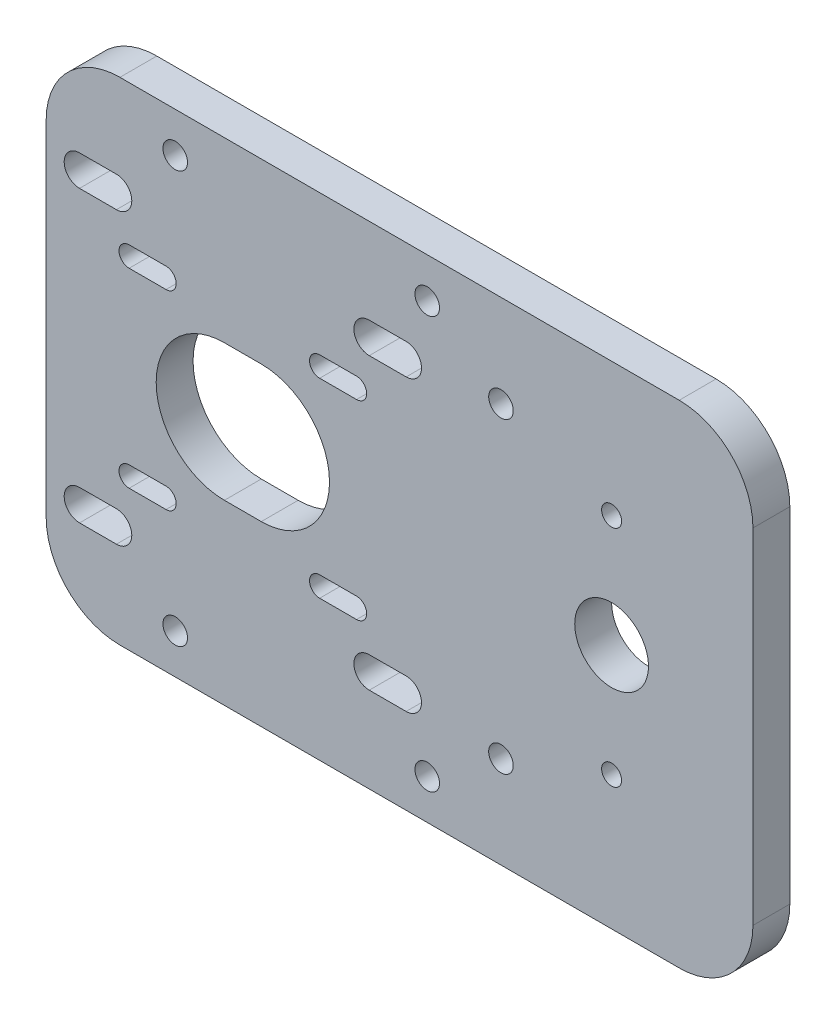
from build123d import *

# Parameters (mm, degrees)
CROQUIS1_W              = 115
CROQUIS1_H              = 80
SALIENTE_EXTRUIR1_DEPTH = 6
CROQUIS2_R              = 6
CROQUIS2_R_2            = 1.625
CROQUIS2_R_3            = 2
CORTAR_EXTRUIR1_DEPTH   = 141.2176879
REDONDEO1_R             = 12
CROQUIS3_R              = 2
CORTAR_EXTRUIR2_DEPTH   = 141.2176879


with BuildPart() as part:
    # Croquis1 → Saliente-Extruir1 (new body)
    with BuildSketch(Plane.XY):
        with Locations((57.5, 40)):
            Rectangle(CROQUIS1_W, CROQUIS1_H)
    extrude(amount=SALIENTE_EXTRUIR1_DEPTH)

    # Croquis2 → Cortar-Extruir1 (cut, through all)
    with BuildSketch(Plane(origin=(0, 0, 0), x_dir=(-1, 0, 0), z_dir=(0, 0, -1))):
        with Locations((-92, 40)):
            Circle(CROQUIS2_R)
        with Locations((-92, 21.75)):
            Circle(CROQUIS2_R_2)
        with Locations((-92, 58.25)):
            Circle(CROQUIS2_R_2)
        with Locations((-74, 15)):
            Circle(CROQUIS2_R_3)
        with Locations((-74, 65)):
            Circle(CROQUIS2_R_3)
        with BuildLine():
            Line((-29, 28.9), (-35, 28.9))
            ThreePointArc((-35, 28.9), (-46.1, 40), (-35, 51.1))
            Line((-35, 51.1), (-29, 51.1))
            ThreePointArc((-29, 51.1), (-17.9, 40), (-29, 28.9))
        make_face()
        with BuildLine():
            Line((-13.5, 22.85), (-19.5, 22.85))
            ThreePointArc((-19.5, 22.85), (-21.15, 24.5), (-19.5, 26.15))
            Line((-19.5, 26.15), (-13.5, 26.15))
            ThreePointArc((-13.5, 26.15), (-11.85, 24.5), (-13.5, 22.85))
        make_face()
        with BuildLine():
            Line((-44.5, 53.85), (-50.5, 53.85))
            ThreePointArc((-50.5, 53.85), (-52.15, 55.5), (-50.5, 57.15))
            Line((-50.5, 57.15), (-44.5, 57.15))
            ThreePointArc((-44.5, 57.15), (-42.85, 55.5), (-44.5, 53.85))
        make_face()
        with BuildLine():
            Line((-44.5, 22.85), (-50.5, 22.85))
            ThreePointArc((-50.5, 22.85), (-52.15, 24.5), (-50.5, 26.15))
            Line((-50.5, 26.15), (-44.5, 26.15))
            ThreePointArc((-44.5, 26.15), (-42.85, 24.5), (-44.5, 22.85))
        make_face()
        with BuildLine():
            Line((-13.5, 53.85), (-19.5, 53.85))
            ThreePointArc((-19.5, 53.85), (-21.15, 55.5), (-19.5, 57.15))
            Line((-19.5, 57.15), (-13.5, 57.15))
            ThreePointArc((-13.5, 57.15), (-11.85, 55.5), (-13.5, 53.85))
        make_face()
        with BuildLine():
            Line((-52.57, 13.93), (-58.57, 13.93))
            ThreePointArc((-58.57, 13.93), (-61.07, 16.43), (-58.57, 18.93))
            Line((-58.57, 18.93), (-52.57, 18.93))
            ThreePointArc((-52.57, 18.93), (-50.07, 16.43), (-52.57, 13.93))
        make_face()
        with BuildLine():
            Line((-5.43, 13.93), (-11.43, 13.93))
            ThreePointArc((-11.43, 13.93), (-13.93, 16.43), (-11.43, 18.93))
            Line((-11.43, 18.93), (-5.43, 18.93))
            ThreePointArc((-5.43, 18.93), (-2.93, 16.43), (-5.43, 13.93))
        make_face()
        with BuildLine():
            Line((-52.57, 61.07), (-58.57, 61.07))
            ThreePointArc((-58.57, 61.07), (-61.07, 63.57), (-58.57, 66.07))
            Line((-58.57, 66.07), (-52.57, 66.07))
            ThreePointArc((-52.57, 66.07), (-50.07, 63.57), (-52.57, 61.07))
        make_face()
        with BuildLine():
            Line((-5.43, 61.07), (-11.43, 61.07))
            ThreePointArc((-11.43, 61.07), (-13.93, 63.57), (-11.43, 66.07))
            Line((-11.43, 66.07), (-5.43, 66.07))
            ThreePointArc((-5.43, 66.07), (-2.93, 63.57), (-5.43, 61.07))
        make_face()
    extrude(amount=-CORTAR_EXTRUIR1_DEPTH, mode=Mode.SUBTRACT)

    # Redondeo1
    redondeo1_edges = [part.edges().sort_by_distance(p)[0] for p in [
        (115, 0, 3),
        (115, 80, 3),
        (0, 0, 3),
        (0, 80, 3),
    ]]
    fillet(redondeo1_edges, radius=REDONDEO1_R)

    # Croquis3 → Cortar-Extruir2 (cut, through all)
    with BuildSketch(Plane(origin=(0, 0, 0), x_dir=(-1, 0, 0), z_dir=(0, 0, -1))):
        with Locations((-21, 6.5)):
            Circle(CROQUIS3_R)
        with Locations((-62, 6.5)):
            Circle(CROQUIS3_R)
        with Locations((-62, 73.5)):
            Circle(CROQUIS3_R)
        with Locations((-21, 73.5)):
            Circle(CROQUIS3_R)
    extrude(amount=-CORTAR_EXTRUIR2_DEPTH, mode=Mode.SUBTRACT)


solid = part.part
